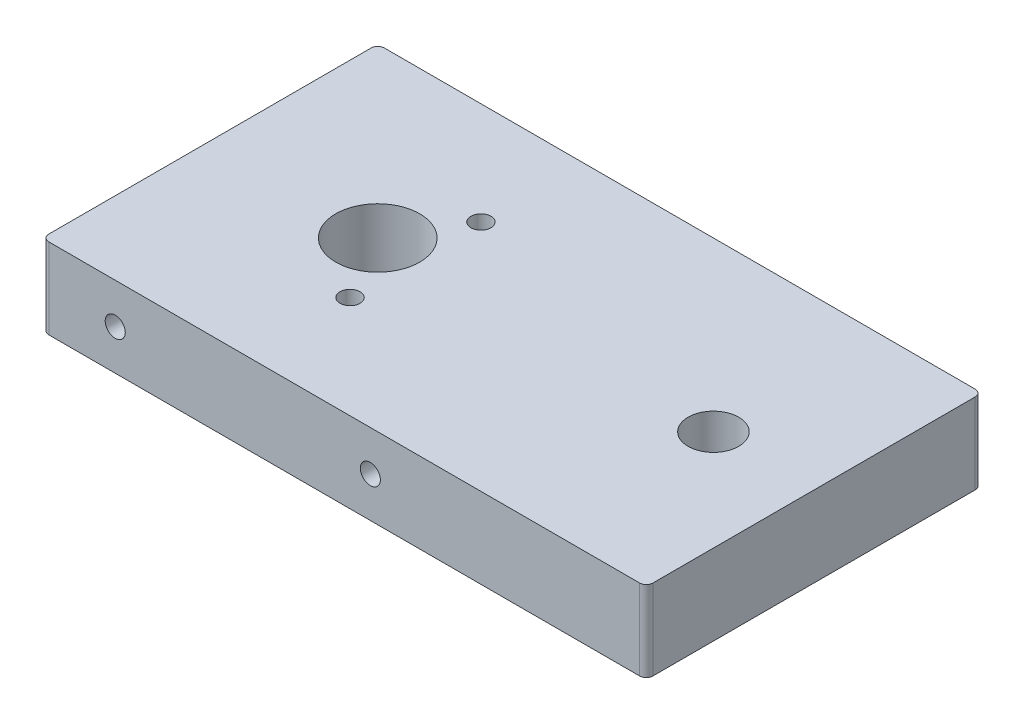
from build123d import *

# Parameters (mm, degrees)
SKETCH1_W                                            = 114.3
SKETCH1_H                                            = 63.5
BOSS_EXTRUDE1_DEPTH                                  = 15.24
F_5_8_0_625_DIAMETER_HOLE1_D                         = 15.875
F_10_24_TAPPED_HOLE3_D                               = 3.7973
CBORE_FOR_3_8_BINDING_HEAD_MACHINE_SCREW_D           = 9.5758
CBORE_FOR_3_8_BINDING_HEAD_MACHINE_SCREW_CBORE_D     = 19.05
CBORE_FOR_3_8_BINDING_HEAD_MACHINE_SCREW_CBORE_DEPTH = 7.62
F_10_24_TAPPED_HOLE1_D                               = 3.7973
F_10_24_TAPPED_HOLE1_DEPTH                           = 10.035175986
F_10_24_TAPPED_HOLE1_TIP                             = 1.140824014
F_10_24_TAPPED_HOLE2_D                               = 3.7973
F_10_24_TAPPED_HOLE2_DEPTH                           = 10.035175986
F_10_24_TAPPED_HOLE2_TIP                             = 1.140824014
FILLET1_R                                            = 1.27


with BuildPart() as part:
    # Sketch1 → Boss-Extrude1 (new body)
    with BuildSketch(Plane(origin=(0, 0, 0), x_dir=(1, 0, 0), z_dir=(0, 1, 0))):
        with Locations((-6.35, 0)):
            Rectangle(SKETCH1_W, SKETCH1_H)
    extrude(amount=BOSS_EXTRUDE1_DEPTH)

    # 5/8 (0.625) Diameter Hole1 (through all)
    with Locations(Plane(origin=(0, 15.24, 0), x_dir=(1, 0, 0), z_dir=(0, 1, 0))):
        with Locations((-31.75, 0)):
            Hole(F_5_8_0_625_DIAMETER_HOLE1_D / 2)

    # #10-24 Tapped Hole3 (through all)
    with Locations(Plane(origin=(0, 15.24, 0), x_dir=(1, 0, 0), z_dir=(0, 1, 0))):
        with Locations((-24.60625, -12.373337957), (-24.60625, 12.373337957)):
            Hole(F_10_24_TAPPED_HOLE3_D / 2)

    # CBORE for 3/8 Binding Head Machine Screw1 (through all)
    with Locations(Plane(origin=(0, 0, 0), x_dir=(-1, 0, 0), z_dir=(0, -1, 0))):
        with Locations((-31.75, 0)):
            CounterBoreHole(CBORE_FOR_3_8_BINDING_HEAD_MACHINE_SCREW_D / 2, CBORE_FOR_3_8_BINDING_HEAD_MACHINE_SCREW_CBORE_D / 2, CBORE_FOR_3_8_BINDING_HEAD_MACHINE_SCREW_CBORE_DEPTH)

    # #10-24 Tapped Hole1
    with Locations(Plane(origin=(0, 0, -31.75), x_dir=(-1, 0, 0), z_dir=(0, 0, -1))):
        with Locations((49.657, 7.62), (1.397, 7.62)):
            Hole(F_10_24_TAPPED_HOLE1_D / 2, depth=F_10_24_TAPPED_HOLE1_DEPTH)
            with Locations((0, 0, -(F_10_24_TAPPED_HOLE1_DEPTH + F_10_24_TAPPED_HOLE1_TIP / 2))):  # 118° drill point
                Cone(0, F_10_24_TAPPED_HOLE1_D / 2, F_10_24_TAPPED_HOLE1_TIP, mode=Mode.SUBTRACT)

    # #10-24 Tapped Hole2
    with Locations(Plane.XY.offset(31.75)):
        with Locations((-49.657, 7.62), (-1.397, 7.62)):
            Hole(F_10_24_TAPPED_HOLE2_D / 2, depth=F_10_24_TAPPED_HOLE2_DEPTH)
            with Locations((0, 0, -(F_10_24_TAPPED_HOLE2_DEPTH + F_10_24_TAPPED_HOLE2_TIP / 2))):  # 118° drill point
                Cone(0, F_10_24_TAPPED_HOLE2_D / 2, F_10_24_TAPPED_HOLE2_TIP, mode=Mode.SUBTRACT)

    # Fillet1
    fillet1_edges = [part.edges().sort_by_distance(p)[0] for p in [
        (50.8, 7.62, 31.75),
        (50.8, 7.62, -31.75),
        (-63.5, 7.62, -31.75),
        (-63.5, 7.62, 31.75),
    ]]
    fillet(fillet1_edges, radius=FILLET1_R)


solid = part.part
